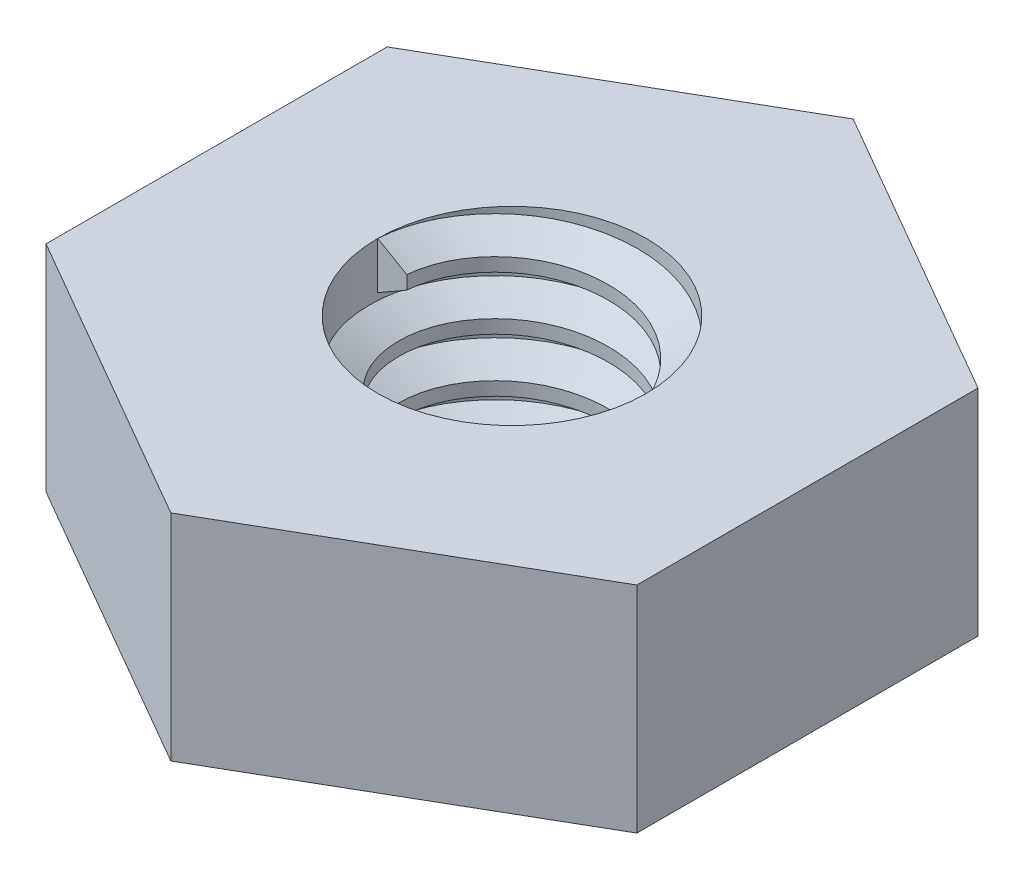
from build123d import *

# Parameters (mm, degrees)
SKETCH1_R           = 1.984375
BOSS_EXTRUDE1_DEPTH = 3.175
THREAD1_PITCH       = 0.79375


with BuildPart() as part:
    # Sketch1 → Boss-Extrude1 (new body)
    with BuildSketch(Plane(origin=(0, 0, 0), x_dir=(1, 0, 0), z_dir=(0, 1, 0))):
        Polygon((0, 5.040989538), (-4.365625, 2.520494769), (-4.365625, -2.520494769), (0, -5.040989538), (4.365625, -2.520494769), (4.365625, 2.520494769), align=None)
        with Locations(Location((0, 0, 0), (0, 0, 270))):
            Circle(SKETCH1_R, mode=Mode.SUBTRACT)
    extrude(amount=BOSS_EXTRUDE1_DEPTH)

    # Thread1: the profile of Thread Profile1 profile screwed along a right-hand helix of 4 turns, 8 arcs to a turn; built about Z, then put on its axis
    thread1_z = Axis((0, 0, 0), (0, 0, 1))
    thread1_corners = [(1.984675, 0, -0.000173205), (1.984675, 0, 0.694704453), (1.554745212, 0, 0.446484374), (1.554745212, 0, 0.248046874)]
    with BuildLine(mode=Mode.PRIVATE) as thread1_profile:
        Line(thread1_corners[0], thread1_corners[1])
        Line(thread1_corners[1], thread1_corners[2])
        Line(thread1_corners[2], thread1_corners[3])
        Line(thread1_corners[3], thread1_corners[0])
    thread1_cap = Face(thread1_profile.wire())
    thread1_turn_angles = [0, 22.5, 45, 67.5, 90, 112.5, 135, 157.5, 180, 202.5, 225, 247.5, 270, 292.5, 315, 337.5, 360]
    thread1_turn_weights = [1, 0.9238795325112867, 1, 0.9238795325112867, 1, 0.9238795325112867, 1, 0.9238795325112867, 1, 0.9238795325112867, 1, 0.9238795325112867, 1, 0.9238795325112867, 1, 0.9238795325112867, 1]
    thread1_turn_rails = [Edge.make_bspline([Vector(p[0], p[1], 0).rotate(thread1_z, thread1_turn_angles[k]) / thread1_turn_weights[k] + Vector(0, 0, p[2] + THREAD1_PITCH * thread1_turn_angles[k] / 360) for k in range(17)], [0, 0, 0, 1, 1, 2, 2, 3, 3, 4, 4, 5, 5, 6, 6, 7, 7, 8, 8, 8], 2, thread1_turn_weights) for p in thread1_corners]
    thread1_turn_sides = [Face.make_surface_from_curves(thread1_turn_rails[p[0]], thread1_turn_rails[p[1]]) for p in [(0, 1), (1, 2), (2, 3), (3, 0)]]
    thread1 = Plane(origin=(0, 3.175, 0), x_dir=(-1, 0, 0), z_dir=(0, -1, 0)) * Solid(Shell([*[p.moved(Location((0, 0, THREAD1_PITCH * i))) for i in range(4) for p in thread1_turn_sides], thread1_cap, thread1_cap.rotate(thread1_z, 1440).moved(Location((0, 0, THREAD1_PITCH * 1440 / 360)))]))
    add(thread1)


solid = part.part
